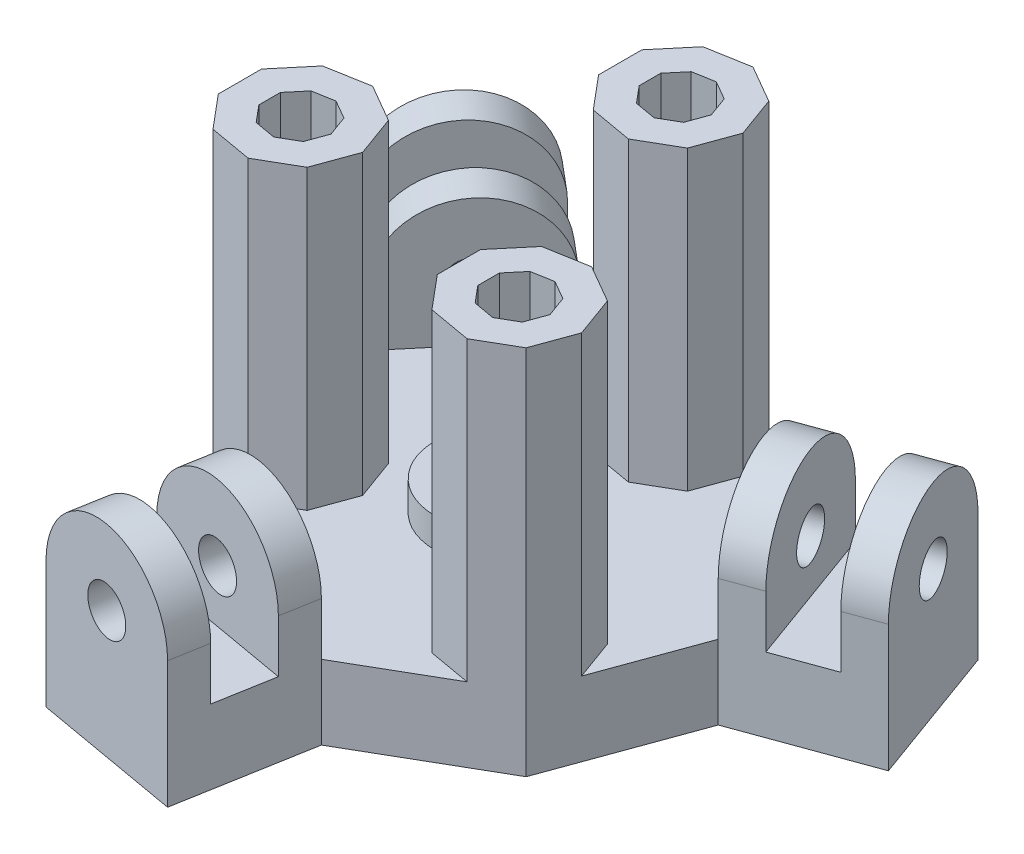
from build123d import *

# Parameters (mm, degrees)
SKETCH1_R            = 4
BOSS_EXTRUDE1_DEPTH  = 6.35
SKETCH4_R            = 1.999996
BOSS_EXTRUDE2_DEPTH  = 3.18
BOSS_EXTRUDE4_START  = -3.175
SKETCH6_R            = 1.999996081
BOSS_EXTRUDE4_DEPTH  = 3.175
SKETCH8_R            = 1.999996
BOSS_EXTRUDE5_DEPTH  = 3.175
BOSS_EXTRUDE6_START  = -3.175
SKETCH9_R            = 1.999996
BOSS_EXTRUDE6_DEPTH  = 3.175
SKETCH10_R           = 1.999996
BOSS_EXTRUDE7_DEPTH  = 3.175
BOSS_EXTRUDE8_START  = -3.175
SKETCH11_R           = 1.999996
BOSS_EXTRUDE8_DEPTH  = 3.175
BOSS_EXTRUDE9_DEPTH  = 25.4
SKETCH15_R           = 5.5
SKETCH15_R_2         = 4
BOSS_EXTRUDE10_DEPTH = 2.54


with BuildPart() as part:
    # Sketch1 → Boss-Extrude1 (new body)
    with BuildSketch(Plane(origin=(0, 0, 0), x_dir=(1, 0, 0), z_dir=(0, 1, 0))):
        Polygon((-17.597636128, 6.405015744), (-17.597636128, -6.405015744), (-9.363506608, -16.218069182), (-11.334413409, -27.39563709), (1.281004917, -29.620075713), (3.251911718, -18.442507805), (14.34572441, -12.037492061), (18.727013216, 0), (29.392524377, 3.881928596), (25.011235571, 15.919420657), (14.34572441, 12.037492061), (3.251911718, 18.442507805), (-9.363506608, 16.218069182), (-18.058110968, 23.513708494), (-26.292240488, 13.700655056), align=None)
        Circle(SKETCH1_R, mode=Mode.SUBTRACT)
    extrude(amount=BOSS_EXTRUDE1_DEPTH)

    # Sketch4 → Boss-Extrude2 (add)
    with BuildSketch(Plane(origin=(-5.026704246, 0, 28.507856402), x_dir=(-0.984807753012208, 0, -0.1736481776669305), z_dir=(0.1736481776669305, 0, -0.9848077530122081))):
        with BuildLine():
            Line((-6.405015744, 6.35), (-6.405015744, 10.84999989))
            ThreePointArc((-6.405015744, 10.84999989), (0, 17.255015634), (6.405015744, 10.84999989))
            Line((6.405015744, 10.84999989), (6.405015744, 6.35))
            Line((6.405015744, 6.35), (-6.405015744, 6.35))
        make_face()
        with Locations((0, 10.84999989)):
            Circle(SKETCH4_R, mode=Mode.SUBTRACT)
    extrude(amount=BOSS_EXTRUDE2_DEPTH)

    # Sketch6 → Boss-Extrude4 (add)
    with BuildSketch(Plane(origin=(-3.055797445, 0, 17.330288494), x_dir=(-0.9848077530122081, 0, -0.17364817766693072), z_dir=(0.17364817766693072, 0, -0.9848077530122081)).offset(BOSS_EXTRUDE4_START)):
        with BuildLine():
            Line((-6.405015744, 6.35), (-6.405015744, 10.85))
            ThreePointArc((-6.405015744, 10.85), (0, 17.255015744), (6.405015744, 10.85))
            Line((6.405015744, 10.85), (6.405015744, 6.35))
            Line((6.405015744, 6.35), (-6.405015744, 6.35))
        make_face()
        with Locations((0, 10.85)):
            Circle(SKETCH6_R, mode=Mode.SUBTRACT)
    extrude(amount=BOSS_EXTRUDE4_DEPTH)

    # Sketch8 → Boss-Extrude5 (add)
    with BuildSketch(Plane(origin=(27.201879974, 0, -9.900674627), x_dir=(0.3420201433256691, 0, 0.9396926207859083), z_dir=(-0.9396926207859084, 0, 0.3420201433256691))):
        with BuildLine():
            Line((-6.405015744, 10.85), (-6.405015744, 6.35))
            Line((-6.405015744, 6.35), (6.405015744, 6.35))
            Line((6.405015744, 6.35), (6.405015744, 10.85))
            ThreePointArc((6.405015744, 10.85), (0, 17.255015744), (-6.405015744, 10.85))
        make_face()
        with Locations((0, 10.85)):
            Circle(SKETCH8_R, mode=Mode.SUBTRACT)
    extrude(amount=BOSS_EXTRUDE5_DEPTH)

    # Sketch9 → Boss-Extrude6 (add)
    with BuildSketch(Plane(origin=(16.536368813, 0, -6.018746031), x_dir=(0.34202014332566877, 0, 0.9396926207859084), z_dir=(-0.9396926207859085, 0, 0.34202014332566877)).offset(BOSS_EXTRUDE6_START)):
        with BuildLine():
            Line((-6.405015744, 6.35), (-6.405015744, 10.85))
            ThreePointArc((-6.405015744, 10.85), (0, 17.255015744), (6.405015744, 10.85))
            Line((6.405015744, 10.85), (6.405015744, 6.35))
            Line((6.405015744, 6.35), (-6.405015744, 6.35))
        make_face()
        with Locations((0, 10.85)):
            Circle(SKETCH9_R, mode=Mode.SUBTRACT)
    extrude(amount=BOSS_EXTRUDE6_DEPTH)

    # Sketch10 → Boss-Extrude7 (add)
    with BuildSketch(Plane(origin=(-22.175175728, 0, -18.607181775), x_dir=(0.6427876096865388, 0, -0.7660444431189786), z_dir=(0.7660444431189786, 0, 0.6427876096865388))):
        with BuildLine():
            Line((-6.405015744, 10.85), (-6.405015744, 6.35))
            Line((-6.405015744, 6.35), (6.405015744, 6.35))
            Line((6.405015744, 6.35), (6.405015744, 10.85))
            ThreePointArc((6.405015744, 10.85), (0, 17.255015744), (-6.405015744, 10.85))
        make_face()
        with Locations((0, 10.85)):
            Circle(SKETCH10_R, mode=Mode.SUBTRACT)
    extrude(amount=BOSS_EXTRUDE7_DEPTH)

    # Sketch11 → Boss-Extrude8 (add)
    with BuildSketch(Plane(origin=(-13.480571368, 0, -11.311542463), x_dir=(0.6427876096865398, 0, -0.7660444431189777), z_dir=(0.7660444431189777, 0, 0.6427876096865398)).offset(BOSS_EXTRUDE8_START)):
        with BuildLine():
            Line((-6.405015744, 10.85), (-6.405015744, 6.35))
            Line((-6.405015744, 6.35), (6.405015744, 6.35))
            Line((6.405015744, 6.35), (6.405015744, 10.85))
            ThreePointArc((6.405015744, 10.85), (0, 17.255015744), (-6.405015744, 10.85))
        make_face()
        with Locations((0, 10.85)):
            Circle(SKETCH11_R, mode=Mode.SUBTRACT)
    extrude(amount=BOSS_EXTRUDE8_DEPTH)

    # Sketch12 → Boss-Extrude9 (add)
    # profile 1 of 3: a face of its own
    with BuildSketch(Plane(origin=(0, 6.35, 0), x_dir=(1, 0, 0), z_dir=(0, 1, 0))):
        Polygon((14.34572441, -12.037492061), (15.610493551, -8.562567405), (14.34572441, -5.087642749), (11.143216524, -3.238673959), (7.501458925, -3.880814081), (5.124470467, -6.713598615), (5.124470467, -10.411536195), (7.501458925, -13.24432073), (11.143216524, -13.886460851), align=None)
        Polygon((12.275097438, -10.300029733), (12.907482009, -8.562567405), (12.275097438, -6.825105077), (10.673843495, -5.900620682), (8.852964696, -6.221690743), (7.664470467, -7.63808301), (7.664470467, -9.4870518), (8.852964696, -10.903444067), (10.673843495, -11.224514128), align=None, mode=Mode.SUBTRACT)
    # profile 2 of 3: a face of its own
    with BuildSketch(Plane(origin=(0, 6.35, 0), x_dir=(1, 0, 0), z_dir=(0, 1, 0))):
        Polygon((6.454419604, 9.643689703), (7.719188745, 13.118614359), (6.454419604, 16.593539015), (3.251911718, 18.442507805), (-0.389845881, 17.800367684), (-2.766834339, 14.967583149), (-2.766834339, 11.269645569), (-0.389845881, 8.436861035), (3.251911718, 7.794720913), align=None)
        Polygon((-0.226834339, 12.194129964), (0.96165989, 10.777737697), (2.78253869, 10.456667636), (4.383792633, 11.381152031), (5.016177203, 13.118614359), (4.383792633, 14.856076687), (2.78253869, 15.780561082), (0.96165989, 15.459491021), (-0.226834339, 14.043098754), align=None, mode=Mode.SUBTRACT)
    # profile 3 of 3: a face of its own
    with BuildSketch(Plane(origin=(0, 6.35, 0), x_dir=(1, 0, 0), z_dir=(0, 1, 0))):
        Polygon((-17.597636128, -6.405015744), (-15.22064767, -9.237800278), (-11.578890071, -9.8799404), (-8.376382185, -8.03097161), (-7.111613044, -4.556046954), (-8.376382185, -1.081122298), (-11.578890071, 0.767846492), (-15.22064767, 0.12570637), (-17.597636128, -2.707078164), align=None)
        Polygon((-10.447009156, -6.293509282), (-9.814624586, -4.556046954), (-10.447009156, -2.818584626), (-12.0482631, -1.894100231), (-13.869141899, -2.215170292), (-15.057636128, -3.631562559), (-15.057636128, -5.480531349), (-13.869141899, -6.896923616), (-12.0482631, -7.217993677), align=None, mode=Mode.SUBTRACT)
    extrude(amount=BOSS_EXTRUDE9_DEPTH)

    # Sketch15 → Boss-Extrude10 (add)
    with BuildSketch(Plane(origin=(0, 6.35, 0), x_dir=(1, 0, 0), z_dir=(0, 1, 0))):
        Circle(SKETCH15_R)
        Circle(SKETCH15_R_2, mode=Mode.SUBTRACT)
    extrude(amount=BOSS_EXTRUDE10_DEPTH)


solid = part.part
